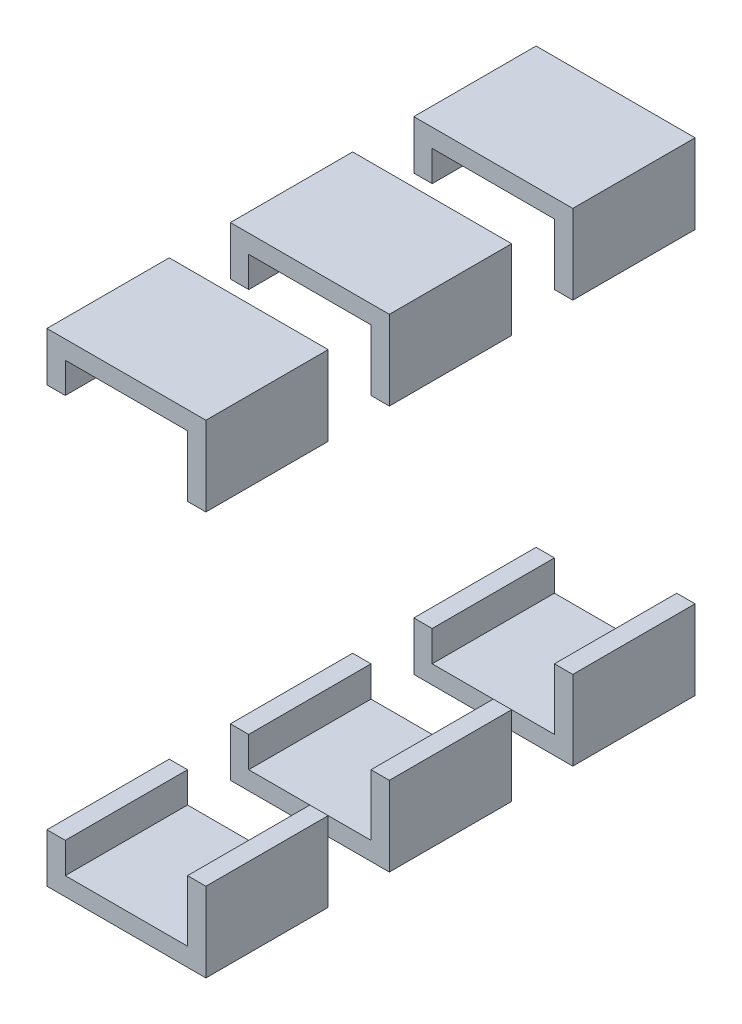
from build123d import *

# Parameters (mm, degrees)
EXTRUDE_1_DEPTH          = 160
CUT_EXTRUDE_2_DEPTH      = 167.400871392
CUT_EXTRUDE_2_DEPTH_BACK = 167.400871392


with BuildPart() as part:
    # 草图1 → 凸台-拉伸1 (new body)
    with BuildSketch(Plane.XY):
        Polygon((-8.639969484, -35.5), (-8.639969484, -39.5), (17.360030516, -39.5), (17.360030516, 39.5), (-8.639969484, 39.5), (-8.639969484, 35.5), (-8.639969484, 31.5), (-5.639969484, 31.5), (-5.639969484, 36.5), (14.360030516, 36.5), (14.360030516, -36.5), (-5.639969484, -36.5), (-5.639969484, -31.5), (-8.639969484, -31.5), align=None)
    extrude(amount=EXTRUDE_1_DEPTH)

    # 草图4 → 切除-拉伸2 (cut, two sides: drawn at the far end of the back side and taken through both)
    with BuildSketch(Plane.ZY.offset(-14.360030516).offset(-CUT_EXTRUDE_2_DEPTH_BACK)):
        Polygon((140, 26.5), (160, 26.5), (160, -26.5), (140, -26.5), (140, -45.304030301), (130, -45.304030301), (130, -26.5), (110, -26.5), (110, -45.304030301), (100, -45.304030301), (100, -26.5), (80, -26.5), (80, -45.304030301), (72.341947093, -45.304030301), (72.341947093, -47.20233834), (-21.576648983, -47.20233834), (-21.576648983, 47.202965292), (72.341947093, 47.202965292), (72.341947093, 45.304030301), (80, 45.304030301), (80, 26.5), (100, 26.5), (100, 45.304030301), (110, 45.304030301), (110, 26.5), (130, 26.5), (130, 45.304030301), (140, 45.304030301), align=None)
    extrude(amount=CUT_EXTRUDE_2_DEPTH + CUT_EXTRUDE_2_DEPTH_BACK, mode=Mode.SUBTRACT)


with BuildPart() as cut_extrude_2_piece_1:
    # of the separate pieces the step leaves, piece 1, a body of its own (cut_extrude_2_pieces)
    add(part.part.solids().sort_by_distance((17.360030516, 39.5, 80))[0])


with BuildPart() as cut_extrude_2_piece_2:
    # of the separate pieces the step leaves, piece 2, a body of its own (cut_extrude_2_pieces)
    add(part.part.solids().sort_by_distance((17.360030516, 39.5, 110))[0])


with BuildPart() as cut_extrude_2_piece_3:
    # of the separate pieces the step leaves, piece 3, a body of its own (cut_extrude_2_pieces)
    add(part.part.solids().sort_by_distance((17.360030516, -39.5, 140))[0])


with BuildPart() as cut_extrude_2_piece_4:
    # of the separate pieces the step leaves, piece 4, a body of its own (cut_extrude_2_pieces)
    add(part.part.solids().sort_by_distance((17.360030516, 39.5, 140))[0])


with BuildPart() as cut_extrude_2_piece_5:
    # of the separate pieces the step leaves, piece 5, a body of its own (cut_extrude_2_pieces)
    add(part.part.solids().sort_by_distance((17.360030516, -39.5, 110))[0])


with BuildPart() as cut_extrude_2_piece_6:
    # of the separate pieces the step leaves, piece 6, a body of its own (cut_extrude_2_pieces)
    add(part.part.solids().sort_by_distance((-8.639969484, -39.5, 80))[0])


solid = Compound([cut_extrude_2_piece_1.part, cut_extrude_2_piece_2.part, cut_extrude_2_piece_3.part, cut_extrude_2_piece_4.part, cut_extrude_2_piece_5.part, cut_extrude_2_piece_6.part])
